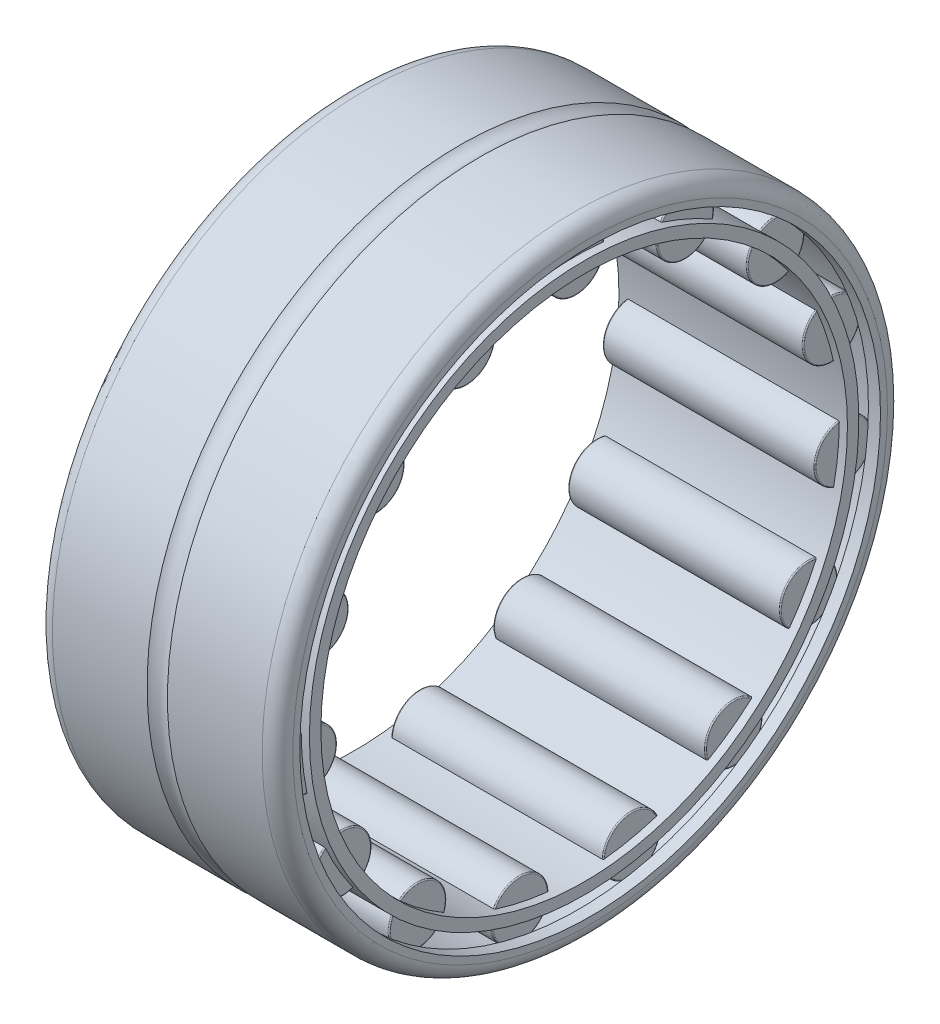
from build123d import *

# Parameters (mm, degrees)
CAGSPISKE_W           = 30.1625
CAGSPISKE_H           = 1.5113
ROLLERSDETAILED_COUNT = 15
ROLLERSDETAILED_ANGLE = 336


with BuildPart() as part:
    # InnRacSke → Race (revolve)
    with BuildSketch(Plane.XY):
        with BuildLine():
            Line((-14.2875, 38.3286), (-15.875, 38.3286))
            Line((-15.875, 38.3286), (-15.875, 39.243))
            ThreePointArc((-15.875, 39.243), (-15.279840979, 40.679840979), (-13.843, 41.275))
            Line((-13.843, 41.275), (-1.344041666, 41.275))
            ThreePointArc((-1.344041666, 41.275), (0, 40.767), (1.344041666, 41.275))
            Line((1.344041666, 41.275), (13.843, 41.275))
            ThreePointArc((13.843, 41.275), (15.279840979, 40.679840979), (15.875, 39.243))
            Line((15.875, 39.243), (15.875, 38.3286))
            Line((15.875, 38.3286), (14.2875, 38.3286))
            Line((14.2875, 38.3286), (14.2875, 39.2811))
            Line((14.2875, 39.2811), (-14.2875, 39.2811))
            Line((-14.2875, 39.2811), (-14.2875, 38.3286))
        make_face()
    revolve(axis=Axis((-31.75, 0, 0), (1, 0, 0)))

    # RolDetSke → RollerDetailed (revolve)
    with BuildSketch(Plane.XY):
        with BuildLine():
            Line((-14.00175, 39.14267), (-14.00175, 35.51555))
            Line((-14.00175, 35.51555), (14.00175, 35.51555))
            Line((14.00175, 35.51555), (14.00175, 39.14267))
            ThreePointArc((14.00175, 39.14267), (13.957485048, 39.249535048), (13.85062, 39.2938))
            Line((13.85062, 39.2938), (-13.85062, 39.2938))
            ThreePointArc((-13.85062, 39.2938), (-13.957485048, 39.249535048), (-14.00175, 39.14267))
        make_face()
    rollerdetailed = revolve(axis=Axis((-28.575, 35.51555, 0), (1, 0, 0)))

    # CagSpiSke → CageSpine (revolve)
    with BuildSketch(Plane.XY):
        with Locations((0, 35.51555)):
            Rectangle(CAGSPISKE_W, CAGSPISKE_H)
    revolve(axis=Axis((-31.75, 0, 0), (1, 0, 0)))

    # RollersDetailed: RollerDetailed ×15 about axis
    rollersdetailed_axis = Axis((-50, 0, 0), (1, 0, 0))
    for i in range(1, ROLLERSDETAILED_COUNT):
        add(rollerdetailed.rotate(rollersdetailed_axis, i * ROLLERSDETAILED_ANGLE / (ROLLERSDETAILED_COUNT - 1)))


solid = part.part
